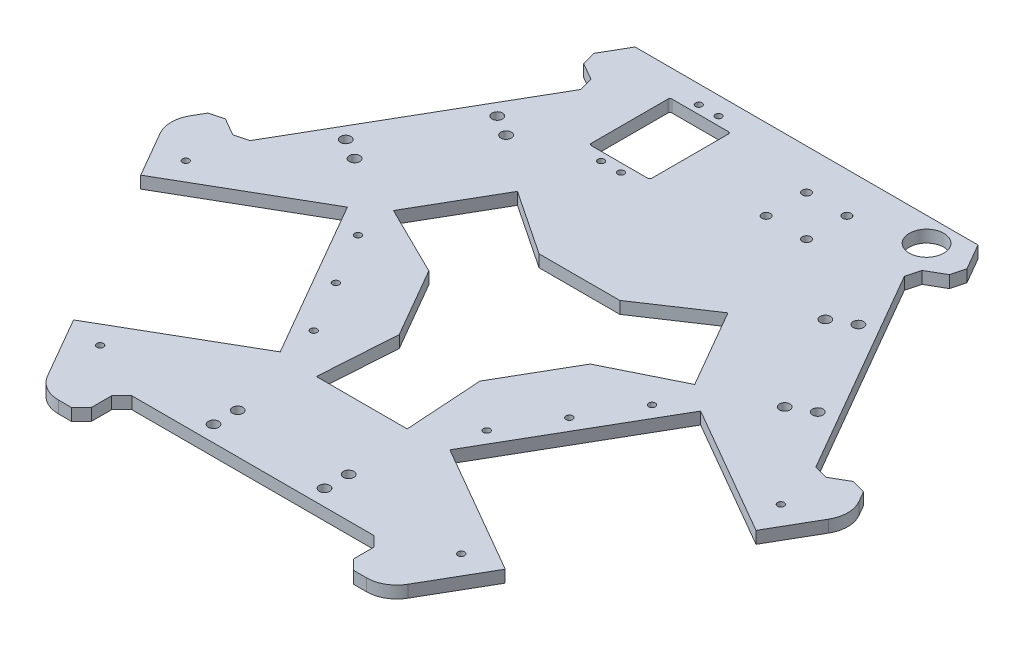
from build123d import *

# Parameters (mm, degrees)
EXTRUDE_1_DEPTH             = 6
CUT_EXTRUDE_31_REACH        = 226.969
SKETCH_46_W                 = 130
SKETCH_46_H                 = 20
SKETCH_8_R                  = 2.6
CUT_EXTRUDE_6_DEPTH         = 225.968886738
PATTERN_CIRCULAR_1_COUNT    = 3
CHAMFER_1_SIZE              = 5
CUT_EXTRUDE_4_DEPTH         = 225.968886738
SKETCH_9_R                  = 1.65
CUT_EXTRUDE_7_DEPTH         = 225.968886738
FILLET_1_R                  = 15
M4X0_7_4_D                  = 3.3
CUT_EXTRUDE_35_REACH        = 225.221
CUT_EXTRUDE_36_REACH        = 225.221
CUT_EXTRUDE_37_REACH        = 225.221
SKETCH_53_R                 = 2.1
PATTERN_LINEAR_1_COUNT      = 2
PATTERN_LINEAR_1_PITCH      = 20
PATTERN_LINEAR_1_COUNT_DIR2 = 2
PATTERN_LINEAR_1_PITCH_DIR2 = 20
CUT_EXTRUDE_38_REACH        = 225.221
SKETCH_54_R                 = 8.55
SKETCH_56_R                 = 1.6
CUT_EXTRUDE_40_DEPTH        = 10
SKETCH_55_W                 = 30
SKETCH_55_H                 = 40
CUT_EXTRUDE_39_DEPTH        = 10
FILLET_2_R                  = 1


with BuildPart() as part:
    # 草圖1 → 填料-伸長1 (new body)
    with BuildSketch(Plane(origin=(0, 0, 0), x_dir=(1, 0, 0), z_dir=(0, 1, 0))):
        Polygon((85, 147.224318643), (-85, 147.224318643), (-170, 0), (-85, -147.224318643), (85, -147.224318643), (170, 0), align=None)
    extrude(amount=EXTRUDE_1_DEPTH)

    # 草圖46 → 除料-伸長31 (cut, up to next)
    with BuildSketch(Plane(origin=(0, 6, 0), x_dir=(1, 0, 0), z_dir=(0, 1, 0)), mode=Mode.PRIVATE) as cut_extrude_31_sk1:
        with Locations((0, -137.224318643)):
            Rectangle(SKETCH_46_W, SKETCH_46_H)
    cut_extrude_31_tool1 = extrude(cut_extrude_31_sk1.sketch, amount=-CUT_EXTRUDE_31_REACH, mode=Mode.PRIVATE) & part.part
    cut_extrude_31 = cut_extrude_31_tool1.solids().sort_by_distance((0, 6, 137.224319))[0]
    add(cut_extrude_31, mode=Mode.SUBTRACT)

    # 草圖8 → 除料-伸長6 (cut, through all)
    with BuildSketch(Plane(origin=(0, 6, 0), x_dir=(1, 0, 0), z_dir=(0, 1, 0))):
        with Locations((-27.5, -119.224318643)):
            Circle(SKETCH_8_R)
        with Locations((27.5, -119.224318643)):
            Circle(SKETCH_8_R)
        with Locations((-27.5, -107.224318643)):
            Circle(SKETCH_8_R)
        with Locations((27.5, -107.224318643)):
            Circle(SKETCH_8_R)
    cut_extrude_6 = extrude(amount=-CUT_EXTRUDE_6_DEPTH, mode=Mode.SUBTRACT)

    # 環狀複製排列1: 除料-伸長31, 除料-伸長6 ×3 about axis
    pattern_circular_1_axis = Axis((0, -0.25, 0), (0, 1, 0))
    add([cut_extrude_31.rotate(pattern_circular_1_axis, i * 360 / PATTERN_CIRCULAR_1_COUNT) for i in range(1, PATTERN_CIRCULAR_1_COUNT)], mode=Mode.SUBTRACT)
    add([cut_extrude_6.rotate(pattern_circular_1_axis, i * 360 / PATTERN_CIRCULAR_1_COUNT) for i in range(1, PATTERN_CIRCULAR_1_COUNT)], mode=Mode.SUBTRACT)

    # 導角1
    chamfer_1_edges = [part.edges().sort_by_distance(p)[0] for p in [
        (65, 3, 127.224318643),
        (65, 3, 147.224318643),
        (-65, 3, 147.224318643),
        (-65, 3, 127.224318643),
        (77.679491924, 3, -119.903810568),
        (95, 3, -129.903810568),
        (160, 3, -17.320508076),
        (142.679491924, 3, -7.320508076),
        (-160, 3, -17.320508076),
        (-142.679491924, 3, -7.320508076),
        (-77.679491924, 3, -119.903810568),
        (-95, 3, -129.903810568),
    ]]
    chamfer(chamfer_1_edges, length=CHAMFER_1_SIZE)

    # 草圖5 → 除料-伸長4 (cut, through all)
    with BuildSketch(Plane(origin=(0, 6, 0), x_dir=(1, 0, 0), z_dir=(0, 1, 0))):
        Polygon((-152.5, -30.310889132), (-107, -109.119200877), (-42.048094716, -71.619200877), (-87.548094716, 7.189110868), align=None)
    cut_extrude_4 = extrude(amount=-CUT_EXTRUDE_4_DEPTH, mode=Mode.SUBTRACT)

    # 草圖9 → 除料-伸長7 (cut, through all)
    with BuildSketch(Plane(origin=(0, 6, 0), x_dir=(1, 0, 0), z_dir=(0, 1, 0))):
        with Locations((-89.491669751, -113.444518424)):
            Circle(SKETCH_9_R)
        with Locations((-147.491669751, -12.985571585)):
            Circle(SKETCH_9_R)
    cut_extrude_7 = extrude(amount=-CUT_EXTRUDE_7_DEPTH, mode=Mode.SUBTRACT)

    # 鏡射1: 除料-伸長4, 除料-伸長7 across plane
    add(cut_extrude_4.mirror(Plane(origin=(0, 0, 0), x_dir=(0, 0, 1), z_dir=(1, 0, 0))), mode=Mode.SUBTRACT)
    add(cut_extrude_7.mirror(Plane(origin=(0, 0, 0), x_dir=(0, 0, 1), z_dir=(1, 0, 0))), mode=Mode.SUBTRACT)

    # 圓角1
    fillet_1_edges = [part.edges().sort_by_distance(p)[0] for p in [
        (170, 3, 0),
        (85, 3, 147.224318643),
        (-170, 3, 0),
        (-85, 3, 147.224318643),
    ]]
    fillet(fillet_1_edges, radius=FILLET_1_R)

    # M4x0.7 螺紋孔4 (through all)
    with Locations(Plane(origin=(0, 6, 0), x_dir=(1, 0, 0), z_dir=(0, 1, 0))):
        with Locations((-72.869891486, -2.234282891), (-57.869891486, -28.215045005), (-42.869891486, -54.195807118)):
            m4x0_7_4 = Hole(M4X0_7_4_D / 2)

    # 鏡射2: M4x0.7 螺紋孔4 across plane
    add(m4x0_7_4.mirror(Plane(origin=(0, 0, 0), x_dir=(0, 0, 1), z_dir=(1, 0, 0))), mode=Mode.SUBTRACT)

    # 草圖51 → 除料-伸長35 (cut, up to next)
    with BuildSketch(Plane(origin=(0, 6, 0), x_dir=(1, 0, 0), z_dir=(0, 1, 0)), mode=Mode.PRIVATE) as cut_extrude_35_sk1:
        Polygon((20, 34.641016151), (-20, 34.641016151), (-40, 0), (-20, -34.641016151), (20, -34.641016151), (40, 0), align=None)
    cut_extrude_35_tool1 = extrude(cut_extrude_35_sk1.sketch, amount=-CUT_EXTRUDE_35_REACH, mode=Mode.PRIVATE) & part.part
    add(cut_extrude_35_tool1.solids().sort_by_distance((0, 6, 0))[0], mode=Mode.SUBTRACT)

    # 草圖52 → 除料-伸長36 (cut, up to next)
    with BuildSketch(Plane(origin=(0, 6, 0), x_dir=(1, 0, 0), z_dir=(0, 1, 0)), mode=Mode.PRIVATE) as cut_extrude_36_sk1:
        Polygon((-22.5, -73.224318643), (22.5, -73.224318643), (20, -34.641016151), (-20, -34.641016151), align=None)
    cut_extrude_36_tool1 = extrude(cut_extrude_36_sk1.sketch, amount=-CUT_EXTRUDE_36_REACH, mode=Mode.PRIVATE) & part.part
    # 草圖52 → 除料-伸長36 (cut, up to next)
    with BuildSketch(Plane(origin=(0, 6, 0), x_dir=(1, 0, 0), z_dir=(0, 1, 0)), mode=Mode.PRIVATE) as cut_extrude_36_sk2:
        Polygon((-20, 34.641016151), (-52.16412012, 56.097730907), (-74.66412012, 17.126587737), (-40, 0), align=None)
    cut_extrude_36_tool2 = extrude(cut_extrude_36_sk2.sketch, amount=-CUT_EXTRUDE_36_REACH, mode=Mode.PRIVATE) & part.part
    # 草圖52 → 除料-伸長36 (cut, up to next)
    with BuildSketch(Plane(origin=(0, 6, 0), x_dir=(1, 0, 0), z_dir=(0, 1, 0)), mode=Mode.PRIVATE) as cut_extrude_36_sk3:
        Polygon((40, 0), (74.66412012, 17.126587737), (52.16412012, 56.097730907), (20, 34.641016151), align=None)
    cut_extrude_36_tool3 = extrude(cut_extrude_36_sk3.sketch, amount=-CUT_EXTRUDE_36_REACH, mode=Mode.PRIVATE) & part.part
    add(cut_extrude_36_tool1.solids().sort_by_distance((0, 6, 54.310935))[0], mode=Mode.SUBTRACT)
    add(cut_extrude_36_tool2.solids().sort_by_distance((-47.034649, 6, -27.155468))[0], mode=Mode.SUBTRACT)
    add(cut_extrude_36_tool3.solids().sort_by_distance((47.034649, 6, -27.155468))[0], mode=Mode.SUBTRACT)

    # 草圖53 → 除料-伸長37 (cut, up to next)
    with BuildSketch(Plane(origin=(0, 6, 0), x_dir=(1, 0, 0), z_dir=(0, 1, 0)), mode=Mode.PRIVATE) as cut_extrude_37_sk1:
        with Locations((20, 127.224318643)):
            Circle(SKETCH_53_R)
    cut_extrude_37_tool1 = extrude(cut_extrude_37_sk1.sketch, amount=-CUT_EXTRUDE_37_REACH, mode=Mode.PRIVATE) & part.part
    cut_extrude_37 = cut_extrude_37_tool1.solids().sort_by_distance((20, 6, -127.224319))[0]
    add(cut_extrude_37, mode=Mode.SUBTRACT)

    # 直線複製排列1: Cut-Extrude 37 2 × 2
    with Locations(*[(i * PATTERN_LINEAR_1_PITCH, 0, j * PATTERN_LINEAR_1_PITCH_DIR2) for i in range(PATTERN_LINEAR_1_COUNT) for j in range(PATTERN_LINEAR_1_COUNT_DIR2) if (i, j) != (0, 0)]):
        add(cut_extrude_37, mode=Mode.SUBTRACT)

    # 草圖54 → 除料-伸長38 (cut, up to next)
    with BuildSketch(Plane(origin=(0, 6, 0), x_dir=(1, 0, 0), z_dir=(0, 1, 0)), mode=Mode.PRIVATE) as cut_extrude_38_sk1:
        with Locations((71.5, 135.224318643)):
            Circle(SKETCH_54_R)
    cut_extrude_38_tool1 = extrude(cut_extrude_38_sk1.sketch, amount=-CUT_EXTRUDE_38_REACH, mode=Mode.PRIVATE) & part.part
    add(cut_extrude_38_tool1.solids().sort_by_distance((71.5, 6, -135.224319))[0], mode=Mode.SUBTRACT)

    # 草圖56 → 除料-伸長40 (cut)
    with BuildSketch(Plane(origin=(0, 0, 0), x_dir=(-1, 0, 0), z_dir=(0, -1, 0))):
        with Locations((34.6, 138.224318643)):
            Circle(SKETCH_56_R)
        with Locations((44.4, 138.224318643)):
            Circle(SKETCH_56_R)
        with Locations((44.4, 89.824318643)):
            Circle(SKETCH_56_R)
        with Locations((34.6, 89.824318643)):
            Circle(SKETCH_56_R)
    extrude(amount=-CUT_EXTRUDE_40_DEPTH, mode=Mode.SUBTRACT)

    # 草圖55 → 除料-伸長39 (cut)
    with BuildSketch(Plane(origin=(0, 6, 0), x_dir=(1, 0, 0), z_dir=(0, 1, 0))):
        with Locations((-39.5, 114.024318643)):
            Rectangle(SKETCH_55_W, SKETCH_55_H)
    extrude(amount=-CUT_EXTRUDE_39_DEPTH, mode=Mode.SUBTRACT)

    # 圓角2
    fillet_2_edges = [part.edges().sort_by_distance(p)[0] for p in [
        (-54.5, 3, -94.024318643),
        (-24.5, 3, -94.024318643),
        (-24.5, 3, -134.024318643),
        (-54.5, 3, -134.024318643),
    ]]
    fillet(fillet_2_edges, radius=FILLET_2_R)


solid = part.part
